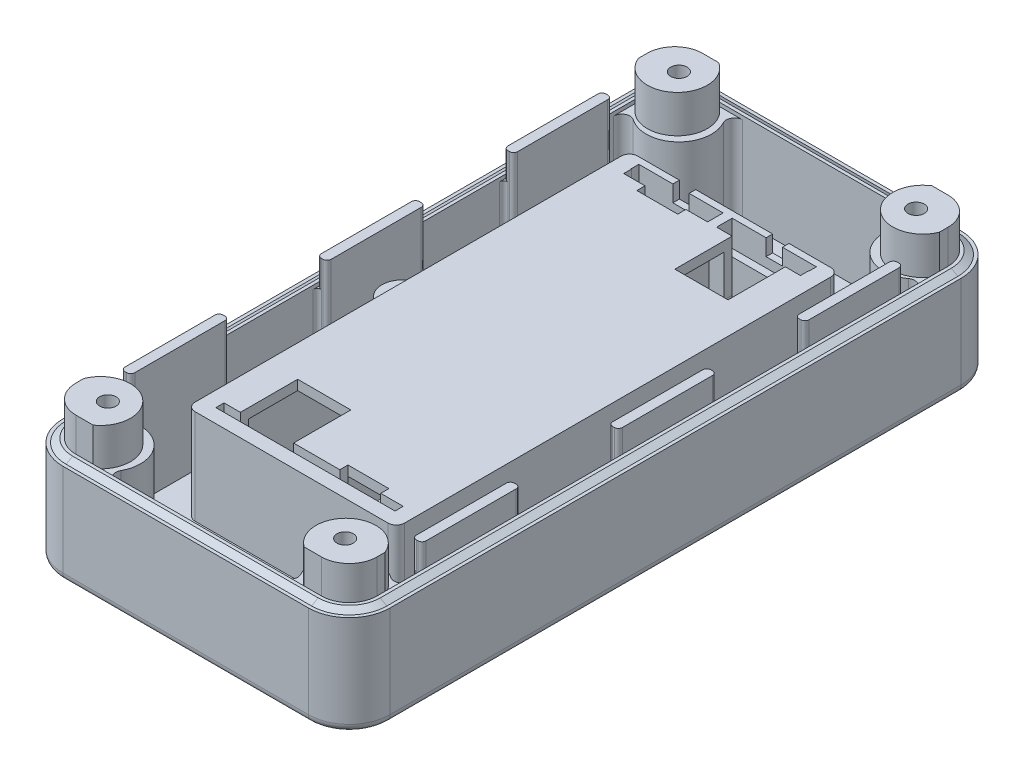
from build123d import *

# Parameters (mm, degrees)
BASE_SKETCH_W                                = 40
BASE_SKETCH_H                                = 79.79
BASE_DEPTH                                   = 12.3
CORNER_ROUNDS_R5_R                           = 5
SHELL_T                                      = -1.6
SKETCH2_R                                    = 4
SCREW_BOSSES_DEPTH                           = 12.3
SKETCH3_W                                    = 1.2
SKETCH3_H                                    = 12
ALIGNMENT_TABS_DEPTH                         = 15.6
BOTTOM_EDGE_ROUND_R1_R                       = 1
LUG_JUNCTION_FILLETS_R1_R                    = 1
FILLET2_R                                    = 0.5
TAB_TOP_CORNER_FILLETS_R0_5_R                = 0.5
BATTERY_COMPARTMENT_BLOCK_SKETCH_W           = 24
BATTERY_COMPARTMENT_BLOCK_SKETCH_H           = 52.5
BATTERY_COMPARTMENT_BLOCK_DEPTH              = 13.2
BATTERY_DOOR_OPENING_SKETCH_W                = 21.6
BATTERY_DOOR_OPENING_SKETCH_H                = 50.1
BATTERY_DOOR_OPENING_DEPTH                   = 1.6
CELL_CHANNELS_10_2_X_46_7_SKETCH_W           = 10.2
CELL_CHANNELS_10_2_X_46_7_SKETCH_H           = 46.7
CELL_CHANNELS_10_2_X_46_7_DEPTH              = 12
DIVIDER_RELIEF_DIVIDER_7_TALL_SKETCH_W       = 1.2
DIVIDER_RELIEF_DIVIDER_7_TALL_SKETCH_H       = 46.7
DIVIDER_RELIEF_DIVIDER_7_TALL_DEPTH          = 5
CLIP_START                                   = 1.6
CLIP_SLOTS_0_7_SKETCH_W                      = 21.9
CLIP_SLOTS_0_7_SKETCH_H                      = 0.7
CLIP_SLOTS_0_7_SKETCH_W_2                    = 10.3
CLIP_SLOTS_0_7_OPEN_TO_PCB_SIDE_DEPTH        = 11.6
M2_PILOT_HOLES_1_6_X_6_FROM_RIM_SKETCH_R     = 0.8
M2_PILOT_HOLES_1_6_X_6_FROM_RIM_DEPTH        = 6
CLIP_STOPS_0_35_DOOR_END_OF_SLOTS_SKET_W     = 7.65
CLIP_STOPS_0_35_DOOR_END_OF_SLOTS_SKET_H     = 0.7
CLIP_STOPS_0_35_DOOR_END_OF_SLOTS_SKET_W_2   = 10.3
CLIP_STOPS_0_35_DOOR_END_OF_SLOTS_DEPTH      = 0.35
CONTACT_OPENINGS_NEAR_U_OPEN_TO_PCB_DEPTH    = 1
CONTACT_OPENINGS_FAR_U_OPEN_TO_PCB_DEPTH     = 1
SPRING_WINDOWS_5X6_BACK_WALL_SKETCH_W        = 5
SPRING_WINDOWS_5X6_BACK_WALL_SKETCH_H        = 6
SPRING_WINDOWS_5X6_BACK_WALL_DEPTH           = 91.607969296
SOLDER_ACCESS_WINDOWS_PLATES_SKET_W          = 10.3
SOLDER_ACCESS_WINDOWS_PLATES_SKET_H          = 1.9
SOLDER_ACCESS_WINDOWS_PLATES_DEPTH           = 3.2
COMPARTMENT_WALLS_0_8_2_0_THICK_SKETC_W      = 25.6
COMPARTMENT_WALLS_0_8_2_0_THICK_SKETC_H      = 54.1
COMPARTMENT_WALLS_0_8_2_0_THICK_SKETC_W_2    = 24
COMPARTMENT_WALLS_0_8_2_0_THICK_SKETC_H_2    = 52.5
COMPARTMENT_WALLS_0_8_2_0_THICK_DEPTH        = 11.6
COMPARTMENT_OUTER_CORNERS_R1_R               = 1
CLIP_SLOTS_WIDENED_TO_0_9_ABOVE_FLO_2_W      = 21.9
CLIP_SLOTS_WIDENED_TO_0_9_ABOVE_FLO_2_H      = 0.25
CLIP_SLOTS_WIDENED_TO_0_9_ABOVE_FLO_2_W_2    = 10.3
CLIP_SLOTS_WIDENED_TO_0_9_ABOVE_FLOOR_DEPTH  = 11.6
CLIP_STOPS_0_9_NEAR_ONE_SOLID_SKETCH_W       = 21.9
CLIP_STOPS_0_9_NEAR_ONE_SOLID_SKETCH_H       = 0.9
CLIP_STOPS_0_9_NEAR_ONE_SOLID_SKETCH_W_2     = 10.3
CLIP_STOPS_0_9_NEAR_ONE_SOLID_DEPTH          = 0.35
SPRING_OPENING_6_5_NEAR_SERIES_SPRING_DEPTH  = 1
SPRING_OPENING_6_5_FAR_SPRING_DEPTH          = 1
SPRING_WINDOWS_WIDENED_TO_6_5_SKETCH_W       = 6.5
SPRING_WINDOWS_WIDENED_TO_6_5_SKETCH_H       = 6
SPRING_WINDOWS_WIDENED_TO_6_5_DEPTH          = 91.607969296
DOOR_SCREW_LUG_5_CENTRED_SKETCH_R            = 2.5
DOOR_SCREW_LUG_5_CENTRED_DEPTH               = 9.4
DOOR_SCREW_PILOT_1_6_X_9_SKETCH_R            = 0.8
DOOR_SCREW_PILOT_1_6_X_9_DEPTH               = 9
DOOR_HOOK_POCKET_X_LONG_EDGE_SKETCH_W        = 0.95
DOOR_HOOK_POCKET_X_LONG_EDGE_SKETCH_H        = 46.3
DOOR_HOOK_POCKET_X_LONG_EDGE_TO_Y1_6_DEPTH   = 0.8
SLOT_ENDS_FLUSH_10_25_SKETCH_W               = 0.3
SLOT_ENDS_FLUSH_10_25_SKETCH_H               = 1
SLOT_ENDS_FLUSH_10_25_DEPTH                  = 11.6
SERIES_SLOT_WIDENED_TO_1_0_SKETCH_W          = 21.9
SERIES_SLOT_WIDENED_TO_1_0_SKETCH_H          = 0.15
SERIES_SLOT_WIDENED_TO_1_0_DEPTH             = 11.6
SLOTS_WIDENED_TO_1_0_SKETCH_W                = 10.25
SLOTS_WIDENED_TO_1_0_SKETCH_H                = 0.15
SLOTS_WIDENED_TO_1_0_DEPTH                   = 11.6
CLIP_STOPS_1_0_SKETCH_W                      = 22
CLIP_STOPS_1_0_SKETCH_H                      = 1.1
CLIP_STOPS_1_0_SKETCH_W_2                    = 10.5
CLIP_STOPS_1_0_DEPTH                         = 0.35
SOLDER_LEG_NOTCHES_2X2_CLIPS_SKET_W          = 2
SOLDER_LEG_NOTCHES_2X2_CLIPS_SKET_H          = 1.8
SOLDER_LEG_NOTCHES_2X2_CLIPS_DEPTH           = 2
CHAMFER2_SIZE                                = 1
PCB_CORNER_GUIDES_R3_663_SKETCH_R            = 3.663
PCB_CORNER_GUIDES_R3_663_TOP_Y16_9_0_4_DEPTH = 4.6
GUIDE_TRIM_TOP_COVER_CAVITY_SKETCH_OUT_W     = 60.168
GUIDE_TRIM_TOP_COVER_CAVITY_SKETCH_OUT_H     = 99.958
GUIDE_TRIM_TOP_COVER_CAVITY_DEPTH            = 5
M2_PILOT_THROUGH_GUIDES_1_6_X_11_SKETCH_R    = 0.8
M2_PILOT_THROUGH_GUIDES_1_6_X_11_DEPTH       = 11
M2_BORES_2_0_GUIDES_SKETCH_R                 = 1
M2_BORES_2_0_GUIDES_DEPTH                    = 11
M2_BORE_2_0_DOOR_LUG_SKETCH_R                = 1
M2_BORE_2_0_DOOR_LUG_DEPTH                   = 9
RIM_START                                    = 0.461880215
RIM_LIP_RING_0_462_DEPTH                     = 0.461880215
RIM_LIP_30DEG_0_4_FLATS_SKETCH_OUTSIDE_W     = 61.768
RIM_LIP_30DEG_0_4_FLATS_SKETCH_OUTSIDE_H     = 101.558
RIM_LIP_30DEG_0_4_FLATS_DEPTH                = 0.461880215
RIM_LIP_30DEG_0_4_FLATS_DRAFT                = -60
GUIDE_0_1_CLEARANCE_SKETCH_OUTSIDE_W         = 60.168
GUIDE_0_1_CLEARANCE_SKETCH_OUTSIDE_H         = 99.958
GUIDE_0_1_CLEARANCE_TO_TOP_COVER_WALLS_DEPTH = 91.162684558
DOOR_EAR_RECESS_0_15_AROUND_THE_EAR_DEPTH    = 1.6
EAR_RECESS_CAP_0_8_LUG_COVERED_INSI_2_W      = 4.78
EAR_RECESS_CAP_0_8_LUG_COVERED_INSI_2_H      = 16.8
EAR_RECESS_CAP_0_8_LUG_COVERED_INSI_2_R      = 1
EAR_RECESS_CAP_0_8_LUG_COVERED_INSIDE_DEPTH  = 0.8
DOOR_CUTOUT_CORNERS_R1_15_R                  = 1.15
DOOR_LUG_BASE_VERTICAL_EDGES_R1_R            = 1


with BuildPart() as part:
    # Base Sketch → Base (new body)
    with BuildSketch(Plane(origin=(0, 0, 0), x_dir=(1, 0, 0), z_dir=(0, 1, 0))):
        with Locations((20, 39.895)):
            Rectangle(BASE_SKETCH_W, BASE_SKETCH_H)
    extrude(amount=BASE_DEPTH)

    # Corner Rounds R5
    corner_rounds_r5_edges = [part.edges().sort_by_distance(p)[0] for p in [
        (0, 6.15, -79.79),
        (40, 6.15, -79.79),
        (40, 6.15, 0),
        (0, 6.15, 0),
    ]]
    fillet(corner_rounds_r5_edges, radius=CORNER_ROUNDS_R5_R)

    # Shell
    shell_openings = [part.faces().sort_by_distance(p)[0] for p in [
        (20, 12.3, -39.895),
    ]]
    offset(amount=SHELL_T, openings=shell_openings, kind=Kind.INTERSECTION)

    # Sketch2 → Screw Bosses (add)
    with BuildSketch(Plane(origin=(0, 0, 0), x_dir=(1, 0, 0), z_dir=(0, 1, 0))):
        with Locations((5.5, 5)):
            Circle(SKETCH2_R)
        with Locations((34.5, 5)):
            Circle(SKETCH2_R)
        with Locations((5.5, 74.79)):
            Circle(SKETCH2_R)
        with Locations((34.5, 74.79)):
            Circle(SKETCH2_R)
    extrude(amount=SCREW_BOSSES_DEPTH)

    # Sketch3 → Alignment Tabs (add)
    with BuildSketch(Plane(origin=(0, 0, 0), x_dir=(1, 0, 0), z_dir=(0, 1, 0))):
        with Locations((2.2, 16.5)):
            Rectangle(SKETCH3_W, SKETCH3_H)
        with Locations((2.2, 40.5)):
            Rectangle(SKETCH3_W, SKETCH3_H)
        with Locations((2.2, 63.29)):
            Rectangle(SKETCH3_W, SKETCH3_H)
        with Locations((37.8, 16.5)):
            Rectangle(SKETCH3_W, SKETCH3_H)
        with Locations((37.8, 40.5)):
            Rectangle(SKETCH3_W, SKETCH3_H)
        with Locations((37.8, 63.29)):
            Rectangle(SKETCH3_W, SKETCH3_H)
    extrude(amount=ALIGNMENT_TABS_DEPTH)

    # Bottom Edge Round R1
    bottom_edge_round_r1_edges = [part.edges().sort_by_distance(p)[0] for p in [
        (0, 0, -39.895),
        (20, 0, -79.79),
        (40, 0, -39.895),
        (20, 0, 0),
        (1.464466094, 0, -1.464466094),
        (38.535533906, 0, -1.464466094),
        (38.535533906, 0, -78.325533906),
        (1.464466094, 0, -78.325533906),
    ]]
    fillet(bottom_edge_round_r1_edges, radius=BOTTOM_EDGE_ROUND_R1_R)

    # Lug Junction Fillets R1
    lug_junction_fillets_r1_edges = [part.edges().sort_by_distance(p)[0] for p in [
        (32.392869249, 6.95, -1.6),
        (38.4, 6.95, -5.888819442),
        (1.6, 6.95, -73.901180558),
        (7.607130751, 6.95, -78.19),
        (38.4, 6.95, -73.901180558),
        (32.392869249, 6.95, -78.19),
        (1.6, 6.95, -5.888819442),
        (7.607130751, 6.95, -1.6),
    ]]
    fillet(lug_junction_fillets_r1_edges, radius=LUG_JUNCTION_FILLETS_R1_R)

    # Fillet2
    fillet2_edges = [part.edges().sort_by_distance(p)[0] for p in [
        (1.6, 6.95, -46.5),
        (1.6, 6.95, -34.5),
        (2.8, 8.6, -34.5),
        (2.8, 8.6, -46.5),
        (1.6, 6.95, -69.29),
        (1.6, 6.95, -57.29),
        (2.8, 8.6, -57.29),
        (2.8, 8.6, -69.29),
        (37.2, 8.6, -22.5),
        (37.2, 8.6, -10.5),
        (38.4, 6.95, -10.5),
        (38.4, 6.95, -22.5),
        (37.2, 8.6, -46.5),
        (37.2, 8.6, -34.5),
        (38.4, 6.95, -34.5),
        (38.4, 6.95, -46.5),
        (37.2, 8.6, -69.29),
        (37.2, 8.6, -57.29),
        (38.4, 6.95, -57.29),
        (38.4, 6.95, -69.29),
        (1.6, 6.95, -22.5),
        (1.6, 6.95, -10.5),
        (2.8, 8.6, -10.5),
        (2.8, 8.6, -22.5),
    ]]
    fillet(fillet2_edges, radius=FILLET2_R)

    # Tab Top Corner Fillets R0.5
    tab_top_corner_fillets_r0_5_edges = [part.edges().sort_by_distance(p)[0] for p in [
        (38.4, 13.95, -57.29),
        (38.4, 13.95, -69.29),
        (38.4, 13.95, -34.5),
        (38.4, 13.95, -46.5),
        (38.4, 13.95, -10.5),
        (38.4, 13.95, -22.5),
        (1.6, 13.95, -57.29),
        (1.6, 13.95, -69.29),
        (1.6, 13.95, -34.5),
        (1.6, 13.95, -46.5),
        (1.6, 13.95, -22.5),
        (1.6, 13.95, -10.5),
    ]]
    fillet(tab_top_corner_fillets_r0_5_edges, radius=TAB_TOP_CORNER_FILLETS_R0_5_R)

    # Battery Compartment Block Sketch → Battery Compartment Block (add)
    with BuildSketch(Plane(origin=(0, 0, 0), x_dir=(1, 0, 0), z_dir=(0, 1, 0))):
        with Locations((20, 40)):
            Rectangle(BATTERY_COMPARTMENT_BLOCK_SKETCH_W, BATTERY_COMPARTMENT_BLOCK_SKETCH_H)
    extrude(amount=BATTERY_COMPARTMENT_BLOCK_DEPTH)

    # Battery Door Opening Sketch → Battery Door Opening (cut)
    with BuildSketch(Plane(origin=(0, 0, 0), x_dir=(1, 0, 0), z_dir=(0, 1, 0))):
        with Locations((20, 40)):
            Rectangle(BATTERY_DOOR_OPENING_SKETCH_W, BATTERY_DOOR_OPENING_SKETCH_H)
    extrude(amount=BATTERY_DOOR_OPENING_DEPTH, mode=Mode.SUBTRACT)

    # Cell Channels 10.2 x 46.7 Sketch → Cell Channels 10.2 x 46.7 (cut)
    with BuildSketch(Plane(origin=(0, 0, 0), x_dir=(1, 0, 0), z_dir=(0, 1, 0))):
        with Locations((14.3, 40)):
            Rectangle(CELL_CHANNELS_10_2_X_46_7_SKETCH_W, CELL_CHANNELS_10_2_X_46_7_SKETCH_H)
        with Locations((25.7, 40)):
            Rectangle(CELL_CHANNELS_10_2_X_46_7_SKETCH_W, CELL_CHANNELS_10_2_X_46_7_SKETCH_H)
    extrude(amount=CELL_CHANNELS_10_2_X_46_7_DEPTH, mode=Mode.SUBTRACT)

    # Divider Relief (divider 7 tall) Sketch → Divider Relief (divider 7 tall) (cut)
    with BuildSketch(Plane(origin=(0, 0, 0), x_dir=(1, 0, 0), z_dir=(0, 1, 0))):
        with Locations((20, 40)):
            Rectangle(DIVIDER_RELIEF_DIVIDER_7_TALL_SKETCH_W, DIVIDER_RELIEF_DIVIDER_7_TALL_SKETCH_H)
    extrude(amount=DIVIDER_RELIEF_DIVIDER_7_TALL_DEPTH, mode=Mode.SUBTRACT)

    # Clip Slots 0.7 Sketch → Clip Slots 0.7 (open to PCB side) (cut)
    with BuildSketch(Plane(origin=(0, 0, 0), x_dir=(1, 0, 0), z_dir=(0, 1, 0)).offset(CLIP_START)):
        with Locations((20, 15.3)):
            Rectangle(CLIP_SLOTS_0_7_SKETCH_W, CLIP_SLOTS_0_7_SKETCH_H)
        with Locations((14.3, 64.7)):
            Rectangle(CLIP_SLOTS_0_7_SKETCH_W_2, CLIP_SLOTS_0_7_SKETCH_H)
        with Locations((25.7, 64.7)):
            Rectangle(CLIP_SLOTS_0_7_SKETCH_W_2, CLIP_SLOTS_0_7_SKETCH_H)
    extrude(amount=CLIP_SLOTS_0_7_OPEN_TO_PCB_SIDE_DEPTH, mode=Mode.SUBTRACT)

    # M2 Pilot Holes 1.6 x 6 (from rim) Sketch → M2 Pilot Holes 1.6 x 6 (from rim) (cut)
    with BuildSketch(Plane(origin=(0, 12.3, 0), x_dir=(1, 0, 0), z_dir=(0, 1, 0))):
        with Locations(Location((5.5, 5, 0), (0, 0, 270))):
            Circle(M2_PILOT_HOLES_1_6_X_6_FROM_RIM_SKETCH_R)
        with Locations(Location((34.5, 5, 0), (0, 0, 270))):
            Circle(M2_PILOT_HOLES_1_6_X_6_FROM_RIM_SKETCH_R)
        with Locations(Location((5.5, 74.79, 0), (0, 0, 270))):
            Circle(M2_PILOT_HOLES_1_6_X_6_FROM_RIM_SKETCH_R)
        with Locations(Location((34.5, 74.79, 0), (0, 0, 270))):
            Circle(M2_PILOT_HOLES_1_6_X_6_FROM_RIM_SKETCH_R)
    extrude(amount=-M2_PILOT_HOLES_1_6_X_6_FROM_RIM_DEPTH, mode=Mode.SUBTRACT)

    # Clip Stops 0.35 (door end of slots) Sketch → Clip Stops 0.35 (door end of slots) (add)
    with BuildSketch(Plane(origin=(0, 1.6, 0), x_dir=(1, 0, 0), z_dir=(0, 1, 0))):
        with Locations((12.875, 15.3)):
            Rectangle(CLIP_STOPS_0_35_DOOR_END_OF_SLOTS_SKET_W, CLIP_STOPS_0_35_DOOR_END_OF_SLOTS_SKET_H)
        with Locations((27.125, 15.3)):
            Rectangle(CLIP_STOPS_0_35_DOOR_END_OF_SLOTS_SKET_W, CLIP_STOPS_0_35_DOOR_END_OF_SLOTS_SKET_H)
        with Locations((14.3, 64.7)):
            Rectangle(CLIP_STOPS_0_35_DOOR_END_OF_SLOTS_SKET_W_2, CLIP_STOPS_0_35_DOOR_END_OF_SLOTS_SKET_H)
        with Locations((25.7, 64.7)):
            Rectangle(CLIP_STOPS_0_35_DOOR_END_OF_SLOTS_SKET_W_2, CLIP_STOPS_0_35_DOOR_END_OF_SLOTS_SKET_H)
    extrude(amount=CLIP_STOPS_0_35_DOOR_END_OF_SLOTS_DEPTH)

    # Contact Openings near (U open to PCB) Sketch → Contact Openings near (U open to PCB) (cut)
    with BuildSketch(Plane.XY.offset(-15.65)):
        with BuildLine():
            Line((16.8, 6.95), (16.8, 13.5))
            Line((16.8, 13.5), (11.8, 13.5))
            Line((11.8, 13.5), (11.8, 6.95))
            ThreePointArc((11.8, 6.95), (14.3, 4.45), (16.8, 6.95))
        make_face()
        with BuildLine():
            Line((28.2, 6.95), (28.2, 13.5))
            Line((28.2, 13.5), (23.2, 13.5))
            Line((23.2, 13.5), (23.2, 6.95))
            ThreePointArc((23.2, 6.95), (25.7, 4.45), (28.2, 6.95))
        make_face()
    extrude(amount=-CONTACT_OPENINGS_NEAR_U_OPEN_TO_PCB_DEPTH, mode=Mode.SUBTRACT)

    # Contact Openings far (U open to PCB) Sketch → Contact Openings far (U open to PCB) (cut)
    with BuildSketch(Plane.XY.offset(-63.35)):
        with BuildLine():
            Line((16.8, 6.95), (16.8, 13.5))
            Line((16.8, 13.5), (11.8, 13.5))
            Line((11.8, 13.5), (11.8, 6.95))
            ThreePointArc((11.8, 6.95), (14.3, 4.45), (16.8, 6.95))
        make_face()
        with BuildLine():
            Line((28.2, 6.95), (28.2, 13.5))
            Line((28.2, 13.5), (23.2, 13.5))
            Line((23.2, 13.5), (23.2, 6.95))
            ThreePointArc((23.2, 6.95), (25.7, 4.45), (28.2, 6.95))
        make_face()
    extrude(amount=-CONTACT_OPENINGS_FAR_U_OPEN_TO_PCB_DEPTH, mode=Mode.SUBTRACT)

    # Spring Windows 5x6 (back wall) Sketch → Spring Windows 5x6 (back wall) (cut, through all)
    with BuildSketch(Plane(origin=(0, 0, 0), x_dir=(1, 0, 0), z_dir=(0, 1, 0))):
        with Locations((14.3, 19.65)):
            Rectangle(SPRING_WINDOWS_5X6_BACK_WALL_SKETCH_W, SPRING_WINDOWS_5X6_BACK_WALL_SKETCH_H)
        with Locations((25.7, 60.35)):
            Rectangle(SPRING_WINDOWS_5X6_BACK_WALL_SKETCH_W, SPRING_WINDOWS_5X6_BACK_WALL_SKETCH_H)
    extrude(amount=SPRING_WINDOWS_5X6_BACK_WALL_DEPTH, mode=Mode.SUBTRACT)

    # Solder Access Windows (+ / - plates) Sketch → Solder Access Windows (+ / - plates) (cut)
    with BuildSketch(Plane(origin=(0, 10, 0), x_dir=(1, 0, 0), z_dir=(0, 1, 0))):
        with Locations((14.3, 65.3)):
            Rectangle(SOLDER_ACCESS_WINDOWS_PLATES_SKET_W, SOLDER_ACCESS_WINDOWS_PLATES_SKET_H)
        with Locations((25.7, 65.3)):
            Rectangle(SOLDER_ACCESS_WINDOWS_PLATES_SKET_W, SOLDER_ACCESS_WINDOWS_PLATES_SKET_H)
    extrude(amount=SOLDER_ACCESS_WINDOWS_PLATES_DEPTH, mode=Mode.SUBTRACT)

    # Compartment Walls +0.8 (2.0 thick) Sketch → Compartment Walls +0.8 (2.0 thick) (add)
    with BuildSketch(Plane(origin=(0, 1.6, 0), x_dir=(1, 0, 0), z_dir=(0, 1, 0))):
        with Locations((20, 40)):
            Rectangle(COMPARTMENT_WALLS_0_8_2_0_THICK_SKETC_W, COMPARTMENT_WALLS_0_8_2_0_THICK_SKETC_H)
        with Locations((20, 40)):
            Rectangle(COMPARTMENT_WALLS_0_8_2_0_THICK_SKETC_W_2, COMPARTMENT_WALLS_0_8_2_0_THICK_SKETC_H_2, mode=Mode.SUBTRACT)
    extrude(amount=COMPARTMENT_WALLS_0_8_2_0_THICK_DEPTH)

    # Compartment Outer Corners R1
    compartment_outer_corners_r1_edges = [part.edges().sort_by_distance(p)[0] for p in [
        (7.2, 7.4, -67.05),
        (7.2, 7.4, -12.95),
        (32.8, 7.4, -12.95),
        (32.8, 7.4, -67.05),
    ]]
    fillet(compartment_outer_corners_r1_edges, radius=COMPARTMENT_OUTER_CORNERS_R1_R)

    # Clip Slots widened to 0.9 _above flo 2 → Clip Slots widened to 0.9 _above floor (cut)
    with BuildSketch(Plane(origin=(0, 1.6, 0), x_dir=(1, 0, 0), z_dir=(0, 1, 0))):
        with Locations((20, 14.875)):
            Rectangle(CLIP_SLOTS_WIDENED_TO_0_9_ABOVE_FLO_2_W, CLIP_SLOTS_WIDENED_TO_0_9_ABOVE_FLO_2_H)
        with Locations((14.3, 65.125)):
            Rectangle(CLIP_SLOTS_WIDENED_TO_0_9_ABOVE_FLO_2_W_2, CLIP_SLOTS_WIDENED_TO_0_9_ABOVE_FLO_2_H)
        with Locations((25.7, 65.125)):
            Rectangle(CLIP_SLOTS_WIDENED_TO_0_9_ABOVE_FLO_2_W_2, CLIP_SLOTS_WIDENED_TO_0_9_ABOVE_FLO_2_H)
    extrude(amount=CLIP_SLOTS_WIDENED_TO_0_9_ABOVE_FLOOR_DEPTH, mode=Mode.SUBTRACT)

    # Clip Stops 0.9 (near one solid) Sketch → Clip Stops 0.9 (near one solid) (add)
    with BuildSketch(Plane(origin=(0, 1.6, 0), x_dir=(1, 0, 0), z_dir=(0, 1, 0))):
        with Locations((20, 15.2)):
            Rectangle(CLIP_STOPS_0_9_NEAR_ONE_SOLID_SKETCH_W, CLIP_STOPS_0_9_NEAR_ONE_SOLID_SKETCH_H)
        with Locations((14.3, 64.8)):
            Rectangle(CLIP_STOPS_0_9_NEAR_ONE_SOLID_SKETCH_W_2, CLIP_STOPS_0_9_NEAR_ONE_SOLID_SKETCH_H)
        with Locations((25.7, 64.8)):
            Rectangle(CLIP_STOPS_0_9_NEAR_ONE_SOLID_SKETCH_W_2, CLIP_STOPS_0_9_NEAR_ONE_SOLID_SKETCH_H)
    extrude(amount=CLIP_STOPS_0_9_NEAR_ONE_SOLID_DEPTH)

    # Spring Opening 6.5 near _series spri 2 → Spring Opening 6.5 near _series spring (cut)
    with BuildSketch(Plane.XY.offset(-15.65)):
        with BuildLine():
            Line((17.55, 6.95), (17.55, 13.5))
            Line((17.55, 13.5), (11.05, 13.5))
            Line((11.05, 13.5), (11.05, 6.95))
            ThreePointArc((11.05, 6.95), (14.3, 3.7), (17.55, 6.95))
        make_face()
    extrude(amount=-SPRING_OPENING_6_5_NEAR_SERIES_SPRING_DEPTH, mode=Mode.SUBTRACT)

    # Spring Opening 6.5 far (- spring) Sketch → Spring Opening 6.5 far (- spring) (cut)
    with BuildSketch(Plane.XY.offset(-63.35)):
        with BuildLine():
            Line((28.95, 6.95), (28.95, 13.5))
            Line((28.95, 13.5), (22.45, 13.5))
            Line((22.45, 13.5), (22.45, 6.95))
            ThreePointArc((22.45, 6.95), (25.7, 3.7), (28.95, 6.95))
        make_face()
    extrude(amount=-SPRING_OPENING_6_5_FAR_SPRING_DEPTH, mode=Mode.SUBTRACT)

    # Spring Windows widened to 6.5 Sketch → Spring Windows widened to 6.5 (cut, through all)
    with BuildSketch(Plane(origin=(0, 0, 0), x_dir=(1, 0, 0), z_dir=(0, 1, 0))):
        with Locations((14.3, 19.65)):
            Rectangle(SPRING_WINDOWS_WIDENED_TO_6_5_SKETCH_W, SPRING_WINDOWS_WIDENED_TO_6_5_SKETCH_H)
        with Locations((25.7, 60.35)):
            Rectangle(SPRING_WINDOWS_WIDENED_TO_6_5_SKETCH_W, SPRING_WINDOWS_WIDENED_TO_6_5_SKETCH_H)
    extrude(amount=SPRING_WINDOWS_WIDENED_TO_6_5_DEPTH, mode=Mode.SUBTRACT)

    # Door Screw Lug 5 (centred) Sketch → Door Screw Lug 5 (centred) (add)
    with BuildSketch(Plane(origin=(0, 1.6, 0), x_dir=(1, 0, 0), z_dir=(0, 1, 0))):
        with Locations((6.5, 40)):
            Circle(DOOR_SCREW_LUG_5_CENTRED_SKETCH_R)
    extrude(amount=DOOR_SCREW_LUG_5_CENTRED_DEPTH)

    # Door Screw Pilot 1.6 x 9 Sketch → Door Screw Pilot 1.6 x 9 (cut)
    with BuildSketch(Plane(origin=(0, 1.6, 0), x_dir=(1, 0, 0), z_dir=(0, 1, 0))):
        with Locations(Location((6.5, 40, 0), (0, 0, 270))):
            Circle(DOOR_SCREW_PILOT_1_6_X_9_SKETCH_R)
    extrude(amount=DOOR_SCREW_PILOT_1_6_X_9_DEPTH, mode=Mode.SUBTRACT)

    # Door Hook Pocket (x+ long edge) Sketch → Door Hook Pocket (x+ long edge, to y1.6) (cut)
    with BuildSketch(Plane(origin=(0, 0.8, 0), x_dir=(1, 0, 0), z_dir=(0, 1, 0))):
        with Locations((31.225, 40)):
            Rectangle(DOOR_HOOK_POCKET_X_LONG_EDGE_SKETCH_W, DOOR_HOOK_POCKET_X_LONG_EDGE_SKETCH_H)
    extrude(amount=DOOR_HOOK_POCKET_X_LONG_EDGE_TO_Y1_6_DEPTH, mode=Mode.SUBTRACT)

    # +/- Slot Ends flush (10.25) Sketch → +/- Slot Ends flush (10.25) (add)
    with BuildSketch(Plane(origin=(0, 1.6, 0), x_dir=(1, 0, 0), z_dir=(0, 1, 0))):
        with Locations((9.05, 64.8)):
            Rectangle(SLOT_ENDS_FLUSH_10_25_SKETCH_W, SLOT_ENDS_FLUSH_10_25_SKETCH_H)
        with Locations((30.95, 64.8)):
            Rectangle(SLOT_ENDS_FLUSH_10_25_SKETCH_W, SLOT_ENDS_FLUSH_10_25_SKETCH_H)
    extrude(amount=SLOT_ENDS_FLUSH_10_25_DEPTH)

    # Series Slot widened to 1.0 Sketch → Series Slot widened to 1.0 (cut)
    with BuildSketch(Plane(origin=(0, 1.6, 0), x_dir=(1, 0, 0), z_dir=(0, 1, 0))):
        with Locations((20, 14.725)):
            Rectangle(SERIES_SLOT_WIDENED_TO_1_0_SKETCH_W, SERIES_SLOT_WIDENED_TO_1_0_SKETCH_H)
    extrude(amount=SERIES_SLOT_WIDENED_TO_1_0_DEPTH, mode=Mode.SUBTRACT)

    # +/- Slots widened to 1.0 Sketch → +/- Slots widened to 1.0 (cut)
    with BuildSketch(Plane(origin=(0, 1.6, 0), x_dir=(1, 0, 0), z_dir=(0, 1, 0))):
        with Locations((14.325, 65.275)):
            Rectangle(SLOTS_WIDENED_TO_1_0_SKETCH_W, SLOTS_WIDENED_TO_1_0_SKETCH_H)
        with Locations((25.675, 65.275)):
            Rectangle(SLOTS_WIDENED_TO_1_0_SKETCH_W, SLOTS_WIDENED_TO_1_0_SKETCH_H)
    extrude(amount=SLOTS_WIDENED_TO_1_0_DEPTH, mode=Mode.SUBTRACT)

    # Clip Stops 1.0 Sketch → Clip Stops 1.0 (add)
    with BuildSketch(Plane(origin=(0, 1.6, 0), x_dir=(1, 0, 0), z_dir=(0, 1, 0))):
        with Locations((20, 15.15)):
            Rectangle(CLIP_STOPS_1_0_SKETCH_W, CLIP_STOPS_1_0_SKETCH_H)
        with Locations((14.25, 64.85)):
            Rectangle(CLIP_STOPS_1_0_SKETCH_W_2, CLIP_STOPS_1_0_SKETCH_H)
        with Locations((25.75, 64.85)):
            Rectangle(CLIP_STOPS_1_0_SKETCH_W_2, CLIP_STOPS_1_0_SKETCH_H)
    extrude(amount=CLIP_STOPS_1_0_DEPTH)

    # Solder Leg Notches 2x2 (+ / - clips) Sketch → Solder Leg Notches 2x2 (+ / - clips) (cut)
    with BuildSketch(Plane(origin=(0, 13.2, 0), x_dir=(1, 0, 0), z_dir=(0, 1, 0))):
        with Locations((14.3, 66.2)):
            Rectangle(SOLDER_LEG_NOTCHES_2X2_CLIPS_SKET_W, SOLDER_LEG_NOTCHES_2X2_CLIPS_SKET_H)
        with Locations((25.7, 66.2)):
            Rectangle(SOLDER_LEG_NOTCHES_2X2_CLIPS_SKET_W, SOLDER_LEG_NOTCHES_2X2_CLIPS_SKET_H)
    extrude(amount=-SOLDER_LEG_NOTCHES_2X2_CLIPS_DEPTH, mode=Mode.SUBTRACT)

    # Chamfer2
    # the kernel refuses this chamfer: 1 mm, written as the material it takes off along each edge
    with BuildSketch(Plane(origin=(30.8, 1.6, -16.85), x_dir=(-0.027495876610585623, 0.9996219169112968, 0), z_dir=(0, 0, -1))) as chamfer2_piece_1_section:
        Polygon((CHAMFER2_SIZE * 0.999621916911, CHAMFER2_SIZE * 0.0274958766106), (-CHAMFER2_SIZE * 0.0274958766106, CHAMFER2_SIZE * 0.999621916911), (0, 0), align=None)
    chamfer2_piece_1 = extrude(amount=46.3, mode=Mode.PRIVATE)
    chamfer2_piece_1 = split(chamfer2_piece_1, bisect_by=Plane(origin=(31.7, 2.239130435, -40), z_dir=(-1, 0, 0)), keep=Keep.TOP, mode=Mode.PRIVATE)
    add(chamfer2_piece_1, mode=Mode.SUBTRACT)

    # PCB Corner Guides R3.663 Sketch → PCB Corner Guides R3.663 (top y16.9, 0.4 gap) (add)
    with BuildSketch(Plane(origin=(0, 12.3, 0), x_dir=(1, 0, 0), z_dir=(0, 1, 0))):
        with Locations(Location((5, 4.6, 0), (0, 0, 90))):
            Circle(PCB_CORNER_GUIDES_R3_663_SKETCH_R)
        with Locations(Location((35, 4.6, 0), (0, 0, 90))):
            Circle(PCB_CORNER_GUIDES_R3_663_SKETCH_R)
        with Locations(Location((5, 75.1, 0), (0, 0, 90))):
            Circle(PCB_CORNER_GUIDES_R3_663_SKETCH_R)
        with Locations(Location((35, 75.1, 0), (0, 0, 90))):
            Circle(PCB_CORNER_GUIDES_R3_663_SKETCH_R)
    extrude(amount=PCB_CORNER_GUIDES_R3_663_TOP_Y16_9_0_4_DEPTH)

    # Guide Trim (top cover cavity) Sketch out → Guide Trim (top cover cavity) (cut)
    with BuildSketch(Plane(origin=(0, 12.3, 0), x_dir=(1, 0, 0), z_dir=(0, 1, 0))):
        with Locations((20, 39.895)):
            Rectangle(GUIDE_TRIM_TOP_COVER_CAVITY_SKETCH_OUT_W, GUIDE_TRIM_TOP_COVER_CAVITY_SKETCH_OUT_H)
        with BuildLine():
            Line((5, 1.5), (35, 1.5))
            ThreePointArc((35, 1.5), (37.474873734, 2.525126266), (38.5, 5))
            Line((38.5, 5), (38.5, 74.79))
            ThreePointArc((38.5, 74.79), (37.474873734, 77.264873734), (35, 78.29))
            Line((35, 78.29), (5, 78.29))
            ThreePointArc((5, 78.29), (2.525126266, 77.264873734), (1.5, 74.79))
            Line((1.5, 74.79), (1.5, 5))
            ThreePointArc((1.5, 5), (2.525126266, 2.525126266), (5, 1.5))
        make_face(mode=Mode.SUBTRACT)
    extrude(amount=GUIDE_TRIM_TOP_COVER_CAVITY_DEPTH, mode=Mode.SUBTRACT)

    # M2 Pilot through guides 1.6 x 11 Sketch → M2 Pilot through guides 1.6 x 11 (cut)
    with BuildSketch(Plane(origin=(0, 17.3, 0), x_dir=(1, 0, 0), z_dir=(0, 1, 0))):
        with Locations(Location((5.5, 5, 0), (0, 0, 270))):
            Circle(M2_PILOT_THROUGH_GUIDES_1_6_X_11_SKETCH_R)
        with Locations(Location((34.5, 5, 0), (0, 0, 270))):
            Circle(M2_PILOT_THROUGH_GUIDES_1_6_X_11_SKETCH_R)
        with Locations(Location((5.5, 74.79, 0), (0, 0, 270))):
            Circle(M2_PILOT_THROUGH_GUIDES_1_6_X_11_SKETCH_R)
        with Locations(Location((34.5, 74.79, 0), (0, 0, 270))):
            Circle(M2_PILOT_THROUGH_GUIDES_1_6_X_11_SKETCH_R)
    extrude(amount=-M2_PILOT_THROUGH_GUIDES_1_6_X_11_DEPTH, mode=Mode.SUBTRACT)

    # M2 Bores 2.0 (guides) Sketch → M2 Bores 2.0 (guides) (cut)
    with BuildSketch(Plane(origin=(0, 17.3, 0), x_dir=(1, 0, 0), z_dir=(0, 1, 0))):
        with Locations(Location((5.5, 5, 0), (0, 0, 270))):
            Circle(M2_BORES_2_0_GUIDES_SKETCH_R)
        with Locations(Location((34.5, 5, 0), (0, 0, 270))):
            Circle(M2_BORES_2_0_GUIDES_SKETCH_R)
        with Locations(Location((5.5, 74.79, 0), (0, 0, 270))):
            Circle(M2_BORES_2_0_GUIDES_SKETCH_R)
        with Locations(Location((34.5, 74.79, 0), (0, 0, 270))):
            Circle(M2_BORES_2_0_GUIDES_SKETCH_R)
    extrude(amount=-M2_BORES_2_0_GUIDES_DEPTH, mode=Mode.SUBTRACT)

    # M2 Bore 2.0 (door lug) Sketch → M2 Bore 2.0 (door lug) (cut)
    with BuildSketch(Plane(origin=(0, 1.6, 0), x_dir=(1, 0, 0), z_dir=(0, 1, 0))):
        with Locations(Location((6.5, 40, 0), (0, 0, 270))):
            Circle(M2_BORE_2_0_DOOR_LUG_SKETCH_R)
    extrude(amount=M2_BORE_2_0_DOOR_LUG_DEPTH, mode=Mode.SUBTRACT)

    # Rim Lip Ring 0.462 Sketch → Rim Lip Ring 0.462 (add)
    with BuildSketch(Plane(origin=(0, 12.3, 0), x_dir=(1, 0, 0), z_dir=(0, 1, 0)).offset(RIM_START)):
        with BuildLine():
            Line((5, 0), (35, 0))
            ThreePointArc((35, 0), (38.535533906, 1.464466094), (40, 5))
            Line((40, 5), (40, 74.79))
            ThreePointArc((40, 74.79), (38.535533906, 78.325533906), (35, 79.79))
            Line((35, 79.79), (5, 79.79))
            ThreePointArc((5, 79.79), (1.464466094, 78.325533906), (0, 74.79))
            Line((0, 74.79), (0, 5))
            ThreePointArc((0, 5), (1.464466094, 1.464466094), (5, 0))
        make_face()
        with BuildLine():
            Line((5, 1.6), (35, 1.6))
            ThreePointArc((35, 1.6), (37.404163056, 2.595836944), (38.4, 5))
            Line((38.4, 5), (38.4, 74.79))
            ThreePointArc((38.4, 74.79), (37.404163056, 77.194163056), (35, 78.19))
            Line((35, 78.19), (5, 78.19))
            ThreePointArc((5, 78.19), (2.595836944, 77.194163056), (1.6, 74.79))
            Line((1.6, 74.79), (1.6, 5))
            ThreePointArc((1.6, 5), (2.595836944, 2.595836944), (5, 1.6))
        make_face(mode=Mode.SUBTRACT)
    extrude(amount=-RIM_LIP_RING_0_462_DEPTH)


with BuildPart() as rim_lip_30deg_0_4_flats_tool:
    # Rim Lip 30deg + 0.4 flats Sketch outside → Rim Lip 30deg + 0.4 flats (with draft: the straight prism first)
    with BuildSketch(Plane(origin=(0, 12.761880215, 0), x_dir=(1, 0, 0), z_dir=(0, 1, 0))):
        with Locations((20, 39.895)):
            Rectangle(RIM_LIP_30DEG_0_4_FLATS_SKETCH_OUTSIDE_W, RIM_LIP_30DEG_0_4_FLATS_SKETCH_OUTSIDE_H)
        with BuildLine():
            Line((5, 1.2), (35, 1.2))
            ThreePointArc((35, 1.2), (37.687005769, 2.312994231), (38.8, 5))
            Line((38.8, 5), (38.8, 74.79))
            ThreePointArc((38.8, 74.79), (37.687005769, 77.477005769), (35, 78.59))
            Line((35, 78.59), (5, 78.59))
            ThreePointArc((5, 78.59), (2.312994231, 77.477005769), (1.2, 74.79))
            Line((1.2, 74.79), (1.2, 5))
            ThreePointArc((1.2, 5), (2.312994231, 2.312994231), (5, 1.2))
        make_face(mode=Mode.SUBTRACT)
    extrude(amount=-RIM_LIP_30DEG_0_4_FLATS_DEPTH)
    # Rim Lip 30deg + 0.4 flats: the draft: its side faces are tilted about the plane it starts from
    rim_lip_30deg_0_4_flats_sides = [rim_lip_30deg_0_4_flats_tool.faces().sort_by_distance(p)[0] for p in [
        (20, 12.530940108, 10.884),
        (50.884, 12.530940108, -39.895),
        (20, 12.530940108, -90.674),
        (-10.884, 12.530940108, -39.895),
        (2.312994231, 12.530940108, -77.477005769),
        (20, 12.530940108, -78.59),
        (37.687005769, 12.530940108, -77.477005769),
        (38.8, 12.530940108, -39.895),
        (37.687005769, 12.530940108, -2.312994231),
        (20, 12.530940108, -1.2),
        (2.312994231, 12.530940108, -2.312994231),
        (1.2, 12.530940108, -39.895),
    ]]
    draft(rim_lip_30deg_0_4_flats_sides, Plane(origin=(0, 12.761880215, 0), x_dir=(1, 0, 0), z_dir=(0, 1, 0)), RIM_LIP_30DEG_0_4_FLATS_DRAFT)


with BuildPart() as part_1:
    add(part.part)

    # Rim Lip 30deg + 0.4 flats: cut by rim_lip_30deg_0_4_flats_tool
    add(rim_lip_30deg_0_4_flats_tool.part, mode=Mode.SUBTRACT)

    # Guide 0.1 Clearance Sketch outside → Guide 0.1 Clearance to top cover walls (cut, through all)
    with BuildSketch(Plane(origin=(0, 12.761880215, 0), x_dir=(1, 0, 0), z_dir=(0, 1, 0))):
        with Locations((20, 39.895)):
            Rectangle(GUIDE_0_1_CLEARANCE_SKETCH_OUTSIDE_W, GUIDE_0_1_CLEARANCE_SKETCH_OUTSIDE_H)
        with BuildLine():
            Line((5, 1.6), (35, 1.6))
            ThreePointArc((35, 1.6), (37.404163056, 2.595836944), (38.4, 5))
            Line((38.4, 5), (38.4, 74.79))
            ThreePointArc((38.4, 74.79), (37.404163056, 77.194163056), (35, 78.19))
            Line((35, 78.19), (5, 78.19))
            ThreePointArc((5, 78.19), (2.595836944, 77.194163056), (1.6, 74.79))
            Line((1.6, 74.79), (1.6, 5))
            ThreePointArc((1.6, 5), (2.595836944, 2.595836944), (5, 1.6))
        make_face(mode=Mode.SUBTRACT)
    extrude(amount=GUIDE_0_1_CLEARANCE_TO_TOP_COVER_WALLS_DEPTH, mode=Mode.SUBTRACT)

    # Door Ear Recess (0.15 around the ear) Sketch → Door Ear Recess (0.15 around the ear) (cut)
    with BuildSketch(Plane(origin=(0, 0, 0), x_dir=(1, 0, 0), z_dir=(0, 1, 0))):
        with BuildLine():
            Line((9.2, 48.223594105), (9.3, 48.223594105))
            Line((9.3, 48.223594105), (9.3, 31.776405895))
            Line((9.3, 31.776405895), (9.2, 31.776405895))
            ThreePointArc((9.2, 31.776405895), (8.188769909, 34.740582946), (5.576764706, 36.468691943))
            ThreePointArc((5.576764706, 36.468691943), (2.85, 40), (5.576764706, 43.531308057))
            ThreePointArc((5.576764706, 43.531308057), (8.188769909, 45.259417054), (9.2, 48.223594105))
        make_face()
    extrude(amount=DOOR_EAR_RECESS_0_15_AROUND_THE_EAR_DEPTH, mode=Mode.SUBTRACT)

    # Ear Recess Cap 0.8 _lug covered insi 2 → Ear Recess Cap 0.8 _lug covered inside (add)
    with BuildSketch(Plane(origin=(0, 1.6, 0), x_dir=(1, 0, 0), z_dir=(0, 1, 0))):
        with Locations((5.21, 40)):
            Rectangle(EAR_RECESS_CAP_0_8_LUG_COVERED_INSI_2_W, EAR_RECESS_CAP_0_8_LUG_COVERED_INSI_2_H)
        with Locations(Location((6.5, 40, 0), (0, 0, 270))):
            Circle(EAR_RECESS_CAP_0_8_LUG_COVERED_INSI_2_R, mode=Mode.SUBTRACT)
    extrude(amount=EAR_RECESS_CAP_0_8_LUG_COVERED_INSIDE_DEPTH)

    # Door Cutout Corners R1.15
    door_cutout_corners_r1_15_edges = [part_1.edges().sort_by_distance(p)[0] for p in [
        (9.2, 0.8, -65.05),
        (9.2, 0.8, -14.95),
        (30.8, 0.8, -14.95),
        (30.8, 0.8, -65.05),
    ]]
    fillet(door_cutout_corners_r1_15_edges, radius=DOOR_CUTOUT_CORNERS_R1_15_R)

    # Door Lug + Base Vertical Edges R1
    door_lug_base_vertical_edges_r1_edges = [part_1.edges().sort_by_distance(p)[0] for p in [
        (7.2, 6.7, -42.4),
        (7.2, 6.7, -37.6),
        (7.2, 2, -31.6),
        (2.82, 2, -31.6),
        (7.2, 2, -48.4),
        (2.82, 2, -48.4),
    ]]
    fillet(door_lug_base_vertical_edges_r1_edges, radius=DOOR_LUG_BASE_VERTICAL_EDGES_R1_R)


solid = part_1.part
